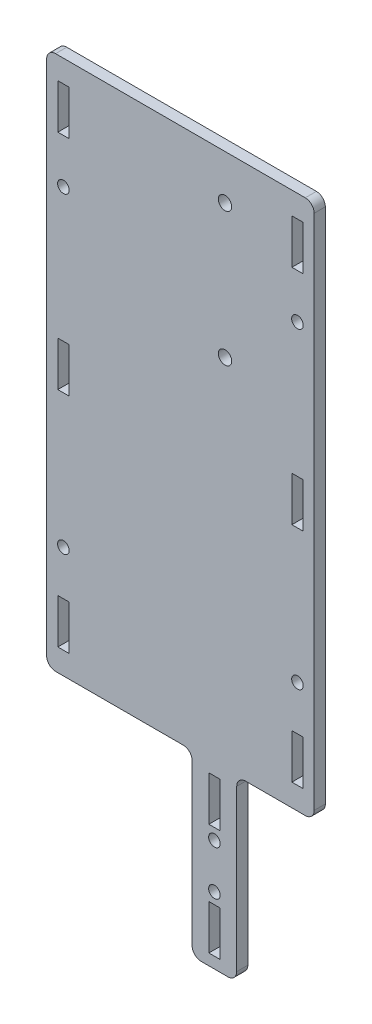
from build123d import *

# Parameters (mm, degrees)
SKETCH1_W           = 3.175
SKETCH1_H           = 12.7
BOSS_EXTRUDE1_DEPTH = 3.175
SKETCH3_W           = 3.175
SKETCH3_H           = 12.7
SKETCH3_R           = 1.651
CUT_EXTRUDE3_DEPTH  = 3.175
SKETCH4_R           = 1.651
CUT_EXTRUDE4_DEPTH  = 3.175
FILLET1_R           = 2.54
SKETCH5_R           = 1.905
CUT_EXTRUDE5_DEPTH  = 3.175


with BuildPart() as part:
    # Sketch1 → Boss-Extrude1 (new body)
    with BuildSketch(Plane.XY):
        Polygon((0, 152.4), (0, 0), (41.4375, 0), (41.4375, -50.8), (54.1375, -50.8), (54.1375, 0), (76.2, 0), (76.2, 152.4), align=None)
        with Locations((47.7875, -9.525)):
            Rectangle(SKETCH1_W, SKETCH1_H, mode=Mode.SUBTRACT)
        with Locations((47.7875, -41.275)):
            Rectangle(SKETCH1_W, SKETCH1_H, mode=Mode.SUBTRACT)
    extrude(amount=BOSS_EXTRUDE1_DEPTH)

    # Sketch3 → Cut-Extrude3 (cut)
    with BuildSketch(Plane.XY.offset(3.175)):
        with Locations((4.7625, 139.7)):
            Rectangle(SKETCH3_W, SKETCH3_H)
        with Locations((4.7625, 12.7)):
            Rectangle(SKETCH3_W, SKETCH3_H)
        with Locations((4.7625, 76.2)):
            Rectangle(SKETCH3_W, SKETCH3_H)
        with Locations((71.4375, 76.2)):
            Rectangle(SKETCH3_W, SKETCH3_H)
        with Locations((71.4375, 12.7)):
            Rectangle(SKETCH3_W, SKETCH3_H)
        with Locations((71.4375, 139.7)):
            Rectangle(SKETCH3_W, SKETCH3_H)
        with Locations((4.7625, 120.65)):
            Circle(SKETCH3_R)
        with Locations((4.7625, 31.75)):
            Circle(SKETCH3_R)
        with Locations((71.4375, 31.75)):
            Circle(SKETCH3_R)
        with Locations((71.4375, 120.65)):
            Circle(SKETCH3_R)
    extrude(amount=-CUT_EXTRUDE3_DEPTH, mode=Mode.SUBTRACT)

    # Sketch4 → Cut-Extrude4 (cut)
    with BuildSketch(Plane.XY.offset(3.175)):
        with Locations((47.7875, -19.05)):
            Circle(SKETCH4_R)
        with Locations((47.7875, -31.75)):
            Circle(SKETCH4_R)
    extrude(amount=-CUT_EXTRUDE4_DEPTH, mode=Mode.SUBTRACT)

    # Fillet1
    fillet1_edges = [part.edges().sort_by_distance(p)[0] for p in [
        (76.2, 152.4, 1.5875),
        (76.2, 0, 1.5875),
        (54.1375, 0, 1.5875),
        (54.1375, -50.8, 1.5875),
        (41.4375, -50.8, 1.5875),
        (41.4375, 0, 1.5875),
        (0, 0, 1.5875),
        (0, 152.4, 1.5875),
    ]]
    fillet(fillet1_edges, radius=FILLET1_R)

    # Sketch5 → Cut-Extrude5 (cut)
    with BuildSketch(Plane.XY.offset(3.175)):
        with Locations((50.8, 139.7)):
            Circle(SKETCH5_R)
        with Locations((50.8, 101.6)):
            Circle(SKETCH5_R)
    extrude(amount=-CUT_EXTRUDE5_DEPTH, mode=Mode.SUBTRACT)


solid = part.part
